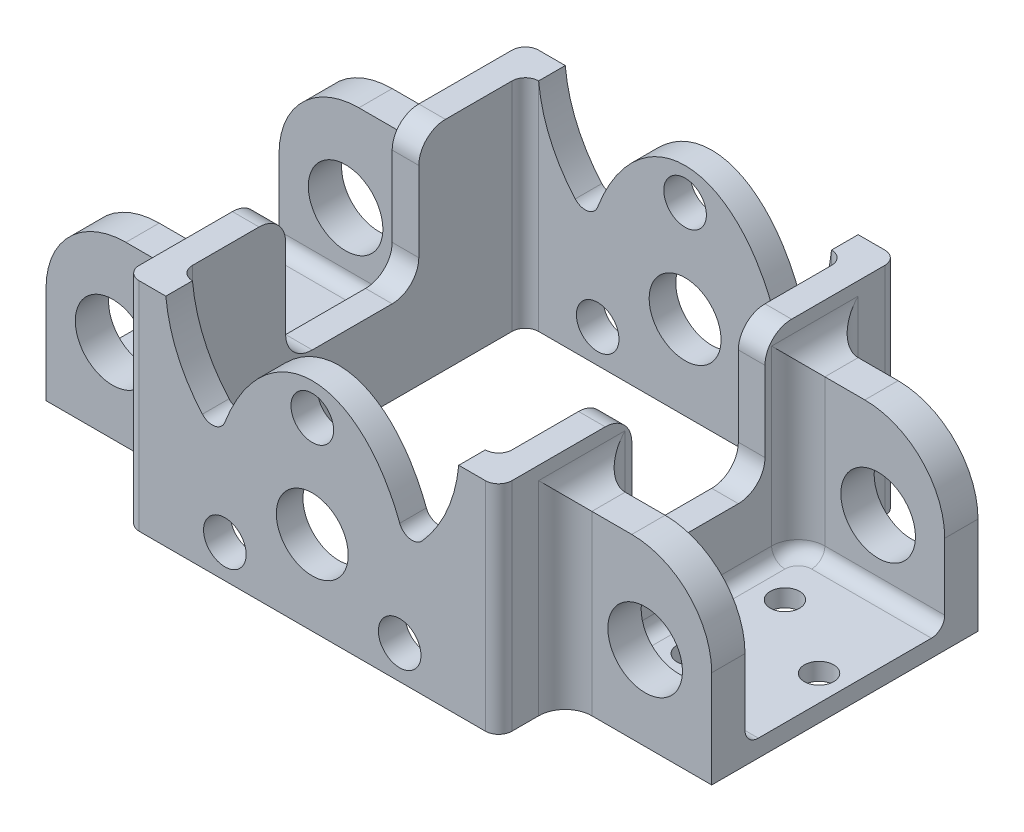
from build123d import *

# Parameters (mm, degrees)
SKETCH1_R           = 3.4290000000000025
SKETCH1_R_2         = 2.032000000000001
SKETCH1_R_3         = 2.03199999999999
SKETCH1_R_4         = 2.032000000000007
SKETCH1_R_5         = 3.5560000000000063
SKETCH1_R_6         = 3.556000000000004
BOSS_EXTRUDE1_DEPTH = 38.1
CUT_EXTRUDE1_DEPTH  = 69.03692379877268
FILLET1_R           = 2.54
FILLET2_R           = 1.27
FILLET3_R           = 1.27
SKETCH3_W           = 13.970000000000013
SKETCH3_H           = 3.810000000000045
SKETCH3_W_2         = 13.970000000000004
CUT_EXTRUDE2_DEPTH  = 70.340139169171
FILLET4_R           = 2.54
CUT_EXTRUDE3_DEPTH  = 68.45362036243867
SKETCH5_R           = 1.3970000000000053
SKETCH5_R_2         = 1.397000000000005
SKETCH5_R_3         = 1.3970000000000065
BOSS_EXTRUDE2_DEPTH = 2.54
FILLET5_R           = 1.27
FILLET6_R           = 7.62
FILLET7_R           = 2.54
FILLET8_R           = 2.54
CUT_EXTRUDE4_DEPTH  = 79.288057837706
CUT_EXTRUDE5_DEPTH  = 70.340139169171
FILLET9_R           = 1.27


with BuildPart() as part:
    # Sketch1 → Boss-Extrude1 (new body)
    with BuildSketch(Plane.XY):
        Polygon((-52.06999999999999, 25.400000000000002), (11.43000000000001, 25.400000000000002), (11.430000000000016, 3.810000000000005), (-52.07, 3.810000000000005), align=None)
        with Locations(Location((-20.319999999999986, 12.700000000000006, 0), (0, 0, 180))):
            Circle(SKETCH1_R, mode=Mode.SUBTRACT)
        with Locations(Location((-11.98311984792871, 7.886700000000026, 0), (0, 0, 180))):
            Circle(SKETCH1_R_2, mode=Mode.SUBTRACT)
        with Locations(Location((-28.656880152071285, 7.886700000000031, 0), (0, 0, 180))):
            Circle(SKETCH1_R_3, mode=Mode.SUBTRACT)
        with Locations(Location((-20.319999999999997, 22.326600000000006, 0), (0, 0, 180))):
            Circle(SKETCH1_R_4, mode=Mode.SUBTRACT)
        with Locations(Location((-45.72000000000003, 12.699999999999982, 0), (0, 0, 180))):
            Circle(SKETCH1_R_5, mode=Mode.SUBTRACT)
        with Locations(Location((5.08000000000005, 12.700000000000038, 0), (0, 0, 180))):
            Circle(SKETCH1_R_6, mode=Mode.SUBTRACT)
    extrude(amount=BOSS_EXTRUDE1_DEPTH)

    # Sketch2 → Cut-Extrude1 (cut, through all)
    with BuildSketch(Plane(origin=(0, 25.400000000000002, 0), x_dir=(1, 0, 0), z_dir=(0, 1, 0))):
        Polygon((-38.09999999999999, -9.525), (-52.06999999999999, -9.524999999999999), (-52.06999999999999, -28.575000000000003), (-38.09999999999999, -28.575000000000003), align=None)
        Polygon((-38.099999999999994, -6.35), (-38.09999999999998, -6.07e-15), (-52.06999999999999, 0), (-52.06999999999999, -6.350000000000001), align=None)
        Polygon((-52.06999999999999, -38.1), (-38.09999999999998, -38.1), (-38.09999999999999, -31.75), (-52.06999999999999, -31.75), align=None)
        Polygon((-5.079999999999991, -2.5400000000000063), (-20.31999999999999, -2.5400000000000063), (-20.319999999999983, -35.559999999999995), (-5.079999999999988, -35.559999999999995), align=None)
        Polygon((-20.319999999999983, -35.559999999999995), (-20.31999999999999, -2.5400000000000063), (-35.55999999999999, -2.540000000000006), (-35.55999999999998, -35.559999999999995), align=None)
        Polygon((11.43000000000001, -28.575), (11.43000000000001, -9.524999999999995), (-2.540000000000001, -9.524999999999999), (-2.539999999999994, -28.575), align=None)
        Polygon((-2.539999999999994, -31.75), (-2.539999999999994, -38.099999999999994), (11.43000000000001, -38.1), (11.43000000000001, -31.749999999999993), align=None)
        Polygon((11.43000000000001, 0), (-2.540000000000001, -6.07e-15), (-2.539999999999994, -6.349999999999997), (11.43000000000001, -6.349999999999998), align=None)
    extrude(amount=-CUT_EXTRUDE1_DEPTH, mode=Mode.SUBTRACT)

    # Fillet1
    fillet1_edges = [part.edges().sort_by_distance(p)[0] for p in [
        (-2.539999999999994, 14.605000000000004, 28.575),
        (-2.540000000000001, 14.605000000000004, 9.524999999999999),
        (-2.539999999999994, 14.605000000000004, 31.75),
        (-2.539999999999994, 14.605000000000004, 6.349999999999997),
        (-38.09999999999999, 14.605000000000004, 28.575000000000003),
        (-38.09999999999999, 14.605000000000004, 9.525),
        (-38.099999999999994, 14.605000000000004, 6.35),
        (-38.09999999999999, 14.605000000000004, 31.75),
    ]]
    fillet(fillet1_edges, radius=FILLET1_R)

    # Fillet2
    fillet2_edges = [part.edges().sort_by_distance(p)[0] for p in [
        (-35.55999999999999, 14.605000000000004, 2.540000000000006),
        (-5.079999999999991, 14.605000000000004, 2.5400000000000063),
        (-5.079999999999988, 14.605000000000004, 35.559999999999995),
        (-35.55999999999998, 14.605000000000004, 35.559999999999995),
    ]]
    fillet(fillet2_edges, radius=FILLET2_R)

    # Fillet3
    fillet3_edges = [part.edges().sort_by_distance(p)[0] for p in [
        (-2.539999999999994, 14.605000000000004, 38.099999999999994),
        (-2.540000000000001, 14.605000000000004, 6.07e-15),
        (-38.09999999999998, 14.605000000000004, 6.07e-15),
        (-38.09999999999998, 14.605000000000004, 38.1),
    ]]
    fillet(fillet3_edges, radius=FILLET3_R)

    # Sketch3 → Cut-Extrude2 (cut, through all)
    with BuildSketch(Plane.XY.offset(38.1)):
        with Locations((-45.08499999999999, 23.49499999999998)):
            Rectangle(SKETCH3_W, SKETCH3_H)
        with Locations((4.445000000000008, 23.49499999999998)):
            Rectangle(SKETCH3_W_2, SKETCH3_H)
    extrude(amount=-CUT_EXTRUDE2_DEPTH, mode=Mode.SUBTRACT)

    # Fillet4
    fillet4_edges = [part.edges().sort_by_distance(p)[0] for p in [
        (-2.539999999999994, 21.589999999999957, 30.1625),
        (-2.539999999999994, 21.589999999999957, 7.9375),
        (-38.09999999999998, 21.589999999999957, 30.1625),
        (-38.09999999999998, 21.589999999999957, 7.9375),
    ]]
    fillet(fillet4_edges, radius=FILLET4_R - 0.0001)  # a hair under: the kernel refuses the full size

    # Sketch4 → Cut-Extrude3 (cut, through all)
    with BuildSketch(Plane.ZY.offset(38.09999999999999)):
        Polygon((12.7, 25.400000000000002), (25.400000000000002, 25.400000000000002), (25.400000000000006, 12.700000000000005), (12.700000000000001, 12.700000000000003), align=None)
    extrude(amount=-CUT_EXTRUDE3_DEPTH, mode=Mode.SUBTRACT)

    # Sketch5 → Boss-Extrude2 (add)
    # profile 1 of 2: a face of its own
    with BuildSketch(Plane.XZ.offset(-3.810000000000005)):
        with BuildLine():
            Line((11.43000000000001, 28.575), (11.430000000000016, 9.525000000000006))
            Line((11.430000000000016, 9.525000000000006), (-1.4e-16, 9.524999999999999))
            ThreePointArc((-1.4e-16, 9.524999999999999), (-1.7960512242138313, 10.26894877578617), (-2.5399999999999996, 12.065000000000001))
            Line((-2.5399999999999996, 12.065000000000001), (-2.5399999999999947, 26.035))
            ThreePointArc((-2.5399999999999947, 26.035), (-1.7960512242138245, 27.83105122421383), (5.58e-15, 28.575))
            Line((5.58e-15, 28.575), (11.43000000000001, 28.575))
        make_face()
        with Locations(Location((8.968965839643676, 19.049999999999986, 0), (0, 0, 90))):
            Circle(SKETCH5_R, mode=Mode.SUBTRACT)
        with Locations(Location((1.2700000000000142, 14.604999999999993, 0), (0, 0, 90))):
            Circle(SKETCH5_R_2, mode=Mode.SUBTRACT)
        with Locations(Location((1.2700000000000142, 23.49499999999999, 0), (0, 0, 90))):
            Circle(SKETCH5_R_3, mode=Mode.SUBTRACT)
    # profile 2 of 2: a face of its own
    with BuildSketch(Plane.XZ.offset(-3.810000000000005)):
        with BuildLine():
            Line((-52.06999999999999, 28.575000000000003), (-52.06999999999999, 9.524999999999999))
            Line((-52.06999999999999, 9.524999999999999), (-40.639999999999986, 9.525))
            ThreePointArc((-40.639999999999986, 9.525), (-38.84394877578615, 10.26894877578617), (-38.09999999999999, 12.065000000000001))
            Line((-38.09999999999999, 12.065000000000001), (-38.09999999999999, 26.035000000000004))
            ThreePointArc((-38.09999999999999, 26.035000000000004), (-38.84394877578615, 27.831051224213834), (-40.639999999999986, 28.575000000000003))
            Line((-40.639999999999986, 28.575000000000003), (-52.06999999999999, 28.575000000000003))
        make_face()
        with Locations(Location((-41.90999999999999, 23.495, 0), (0, 0, 270))):
            Circle(SKETCH5_R, mode=Mode.SUBTRACT)
        with Locations(Location((-41.90999999999999, 14.605, 0), (0, 0, 270))):
            Circle(SKETCH5_R_2, mode=Mode.SUBTRACT)
        with Locations(Location((-49.60896583964365, 19.05, 0), (0, 0, 270))):
            Circle(SKETCH5_R, mode=Mode.SUBTRACT)
    extrude(amount=-BOSS_EXTRUDE2_DEPTH)

    # Fillet5
    fillet5_edges = [part.edges().sort_by_distance(p)[0] for p in [
        (5.715000000000008, 6.350000000000005, 28.575),
        (5.715000000000008, 6.350000000000005, 9.525000000000002),
        (-1.7960512242138313, 6.350000000000005, 10.268948775786168),
        (-2.5399999999999974, 6.350000000000005, 19.05),
        (-1.7960512242138247, 6.350000000000005, 27.83105122421383),
        (-46.35499999999999, 6.350000000000005, 28.575000000000003),
        (-38.84394877578615, 6.350000000000005, 27.831051224213834),
        (-38.09999999999999, 6.350000000000005, 19.050000000000004),
        (-38.84394877578615, 6.350000000000005, 10.268948775786168),
        (-46.35499999999999, 6.350000000000005, 9.524999999999999),
    ]]
    fillet(fillet5_edges, radius=FILLET5_R)

    # Fillet6
    fillet6_edges = [part.edges().sort_by_distance(p)[0] for p in [
        (-52.06999999999999, 21.589999999999957, 30.1625),
        (-52.06999999999999, 21.589999999999957, 7.9375),
        (11.43000000000001, 21.589999999999957, 30.162499999999994),
        (11.43000000000001, 21.589999999999957, 7.9374999999999964),
    ]]
    fillet(fillet6_edges, radius=FILLET6_R)

    # Fillet7
    fillet7_edges = [part.edges().sort_by_distance(p)[0] for p in [
        (-36.829999999999984, 25.400000000000002, 12.7),
        (-3.809999999999995, 25.400000000000002, 12.7),
        (-36.829999999999984, 25.400000000000002, 25.400000000000002),
        (-3.809999999999995, 25.400000000000002, 25.400000000000002),
    ]]
    fillet(fillet7_edges, radius=FILLET7_R)

    # Fillet8
    fillet8_edges = [part.edges().sort_by_distance(p)[0] for p in [
        (-36.829999999999984, 12.700000000000003, 12.700000000000001),
        (-3.809999999999988, 12.700000000000003, 12.700000000000001),
        (-36.829999999999984, 12.700000000000005, 25.400000000000006),
        (-3.809999999999981, 12.700000000000005, 25.400000000000006),
    ]]
    fillet(fillet8_edges, radius=FILLET8_R)

    # Sketch6 → Cut-Extrude4 (cut, through all)
    with BuildSketch(Plane.ZY.offset(52.07)):
        Polygon((0, 3.809999999999993), (38.1, 3.809999999999993), (38.1, 4.6989999999999945), (0, 4.698999999999993), align=None)
    extrude(amount=-CUT_EXTRUDE4_DEPTH, mode=Mode.SUBTRACT)

    # Sketch7 → Cut-Extrude5 (cut, through all)
    with BuildSketch(Plane(origin=(0, 0, 0), x_dir=(-1, 0, 0), z_dir=(0, 0, -1))):
        with BuildLine():
            Line((20.32, 25.400000000000002), (6.350000000000019, 25.400000000000002))
            ThreePointArc((6.350000000000005, 25.39999999999987), (7.9193675352168675, 20.163611361418162), (11.370352764783272, 15.924108869359126))
            add(Edge.make_bspline(
                [(20.31999999999999, 25.400000000000006), (13.983937737960566, 25.400000000000006), (11.370352764782695, 15.924108869359099)],
                knots=[3.141592653589793, 3.141592653589793, 3.141592653589793, 4.287199306163754, 4.287199306163754, 4.287199306163754], degree=2, weights=[1, 0.8403849043406877, 1]))
        make_face()
        with BuildLine():
            ThreePointArc((29.269647235216702, 15.924108869359122), (32.72063246478326, 20.163611361418432), (34.290000000000035, 25.400000000000485))
            Line((34.29000000000008, 25.400000000000002), (20.32, 25.400000000000002))
            add(Edge.make_bspline(
                [(29.26964723521729, 15.924108869359106), (26.65606226203941, 25.400000000000006), (20.31999999999999, 25.400000000000006)],
                knots=[1.9959860010158326, 1.9959860010158326, 1.9959860010158326, 3.141592653589793, 3.141592653589793, 3.141592653589793], degree=2, weights=[1, 0.8403849043406878, 1]))
        make_face()
    extrude(amount=-CUT_EXTRUDE5_DEPTH, mode=Mode.SUBTRACT)

    # Fillet9
    fillet9_edges = [part.edges().sort_by_distance(p)[0] for p in [
        (-11.370352764782984, 15.92410886935911, 1.2700000000000031),
        (-29.269647235216993, 15.924108869359113, 1.2700000000000031),
        (-29.269647235216993, 15.924108869359113, 36.83),
        (-11.370352764782984, 15.92410886935911, 36.83),
    ]]
    fillet(fillet9_edges, radius=FILLET9_R)


solid = part.part
